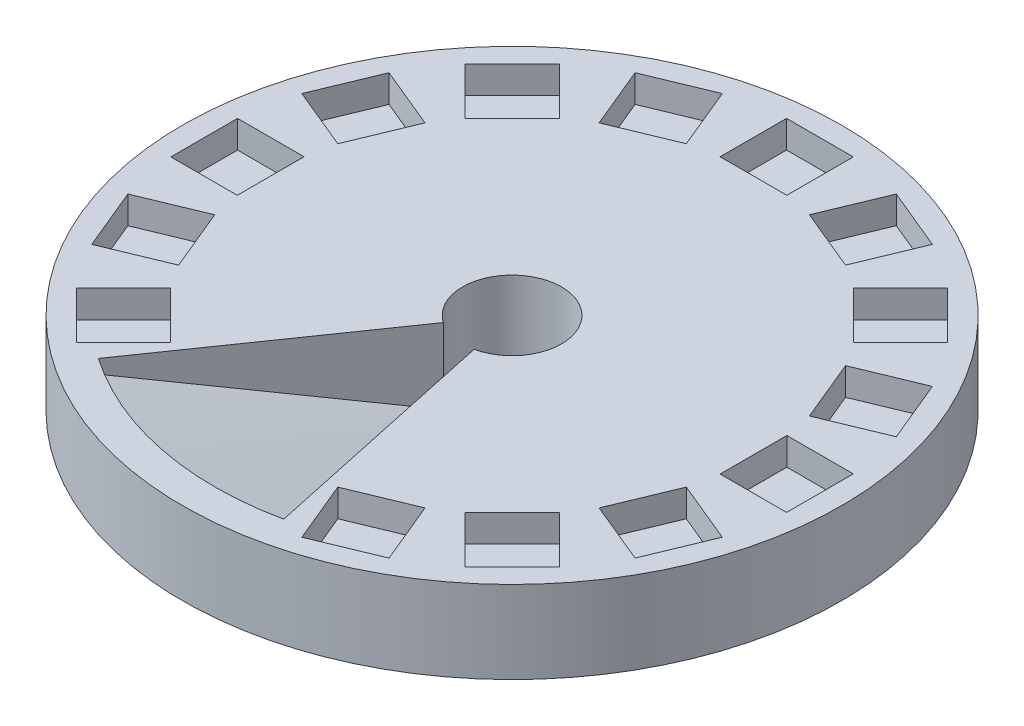
from build123d import *

# Parameters (mm, degrees)
SKETCH3_W          = 12.15
SKETCH3_H          = 12.1
CUT_EXTRUDE1_DEPTH = 5
CIRPATTERN1_COUNT  = 16
CUT_SWEEP3_ANGLE   = 46.890766
SKETCH8_R          = 27.5
SKETCH8_R_2        = 18.5
CUT_EXTRUDE2_DEPTH = 1.85


# Read off the part's stored shape, not the designer's step: Cut-Sweep3
with BuildPart() as part:
    # Sketch1 → Revolve1 (revolve)
    with BuildSketch(Plane(origin=(0, 0, 0), x_dir=(0, 0, -1), z_dir=(1, 0, 0))):
        Polygon((9, 0), (60, 0), (60, -15), (18.5, -15), (18.5, -35), (16.100175422, -35), (16.100175422, -37.6), (18.5, -37.6), (18.5, -41.6), (9, -41.6), align=None)
    revolve(axis=Axis((0, 0, 0), (0, 1, 0)))

    # Sketch3 → Cut-Extrude1 (cut)
    with BuildSketch(Plane(origin=(0, 0, 0), x_dir=(1, 0, 0), z_dir=(0, 1, 0))):
        with Locations((0, 50)):
            Rectangle(SKETCH3_W, SKETCH3_H)
    cut_extrude1 = extrude(amount=-CUT_EXTRUDE1_DEPTH, mode=Mode.SUBTRACT)

    # CirPattern1: Cut-Extrude1 ×16 about axis, 2 skipped
    cirpattern1_axis = Axis((0, 0, 0), (0, -1, 0))
    add([cut_extrude1.rotate(cirpattern1_axis, i * 360 / CIRPATTERN1_COUNT) for i in range(1, CIRPATTERN1_COUNT) if i not in (8, 9)], mode=Mode.SUBTRACT)

    # Cut-Sweep3 outline → Cut-Sweep3 (revolve, cut)
    with BuildSketch(Plane(origin=(0, 0, 0), x_dir=(-0.5705578043075098, 0, 0.8212574455941287), z_dir=(-0.8212574455941287, 0, -0.5705578043075098))):
        Polygon((54.108249649, -2.5), (54.108249649, 0), (9, 0), (9, -13.715253714), align=None)
    revolve(axis=Axis((0, 0, 0), (0, 1, 0)), revolution_arc=CUT_SWEEP3_ANGLE, mode=Mode.SUBTRACT)

    # Sketch8 → Cut-Extrude2 (cut)
    with BuildSketch(Plane.XZ.offset(15)):
        with Locations(Location((0, 0, 0), (0, 0, 270))):
            Circle(SKETCH8_R)
        with Locations(Location((0, 0, 0), (0, 0, 270))):
            Circle(SKETCH8_R_2, mode=Mode.SUBTRACT)
    extrude(amount=-CUT_EXTRUDE2_DEPTH, mode=Mode.SUBTRACT)


solid = part.part
